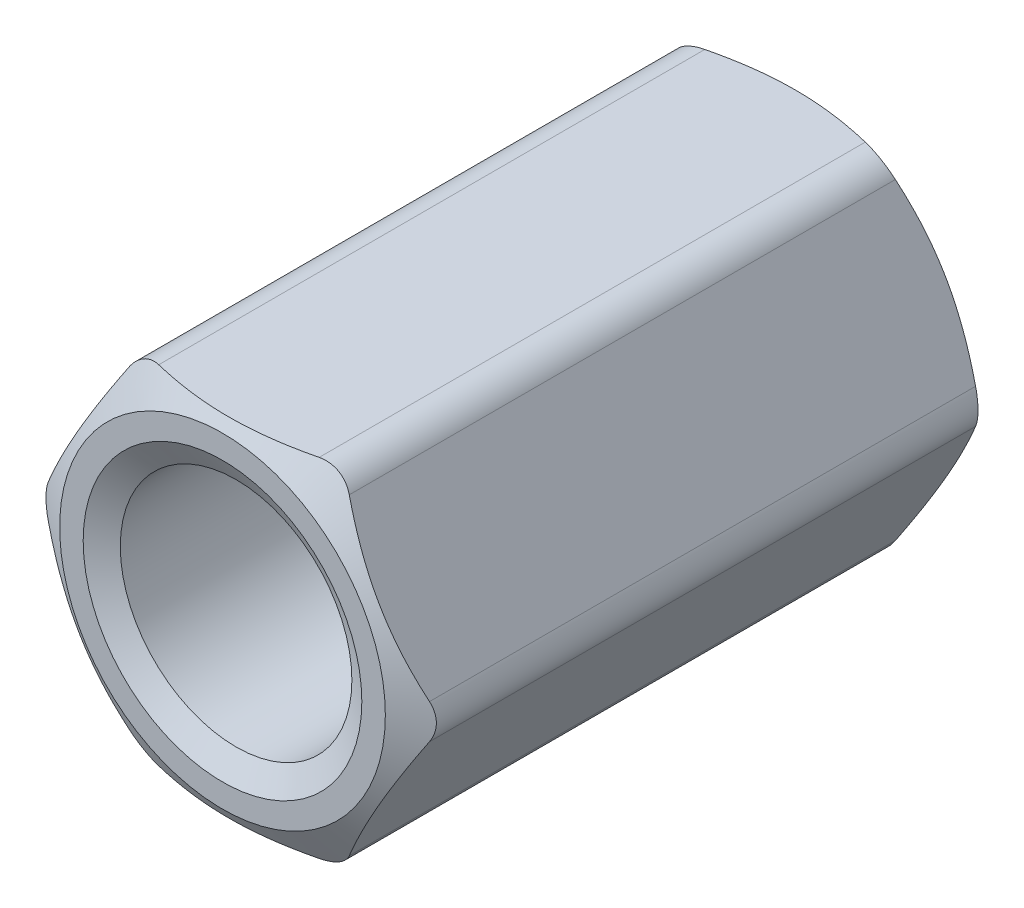
from build123d import *

# Parameters (mm, degrees)
SKETCH4_R           = 2.5
BOSS_EXTRUDE1_DEPTH = 5
SKETCH5_OUTSIDE_W   = 53.21
SKETCH5_OUTSIDE_H   = 52.282
SKETCH5_OUTSIDE_R   = 2.8125
CUT_EXTRUDE1_DEPTH  = 12
CUT_EXTRUDE1_DRAFT  = -60
SKETCH6_OUTSIDE_W   = 53.21
SKETCH6_OUTSIDE_H   = 52.282
SKETCH6_OUTSIDE_R   = 2.8125
CUT_EXTRUDE2_DEPTH  = 12
CUT_EXTRUDE2_DRAFT  = -60
FILLET1_R           = 0.6


with BuildPart() as part:
    # Sketch3 → Revolve1 (revolve)
    with BuildSketch(Plane(origin=(0, 0, 0), x_dir=(0, 0, -1), z_dir=(1, 0, 0)), mode=Mode.PRIVATE) as revolve1_sk:
        Polygon((5, 2.40625), (5, 3), (0, 3), (-5, 3), (-5, 2.40625), (-4.765451453, 2), (4.765451453, 2), align=None)
        Polygon((5, 2.40625), (5, 3), (0, 3), (-5, 3), (-5, 2.40625), (-4.765451453, 2), (4.765451453, 2), align=None)
    revolve(revolve1_sk.sketch.rotate(Axis((0, 0, -5), (0, 0, 1)), 90), axis=Axis((0, 0, -5), (0, 0, 1)))

    # Sketch4 → Boss-Extrude1 (add, symmetric)
    with BuildSketch(Plane.XY):
        Polygon((-1.732050808, 3), (-3.464101615, 0), (-1.732050808, -3), (1.732050808, -3), (3.464101615, 0), (1.732050808, 3), align=None)
        Circle(SKETCH4_R, mode=Mode.SUBTRACT)
    extrude(amount=BOSS_EXTRUDE1_DEPTH, both=True)


with BuildPart() as cut_extrude1_tool:
    # Sketch5 outside → Cut-Extrude1 (with draft: the straight prism first)
    with BuildSketch(Plane.XY.offset(5)):
        Rectangle(SKETCH5_OUTSIDE_W, SKETCH5_OUTSIDE_H)
        Circle(SKETCH5_OUTSIDE_R, mode=Mode.SUBTRACT)
    extrude(amount=-CUT_EXTRUDE1_DEPTH)
    # Cut-Extrude1: the draft: its side faces are tilted about the plane it starts from
    cut_extrude1_sides = [cut_extrude1_tool.faces().sort_by_distance(p)[0] for p in [
        (0, -26.141, -1),
        (26.605, 0, -1),
        (0, 26.141, -1),
        (-26.605, 0, -1),
        (-2.8125, 0, -1),
    ]]
    draft(cut_extrude1_sides, Plane.XY.offset(5), CUT_EXTRUDE1_DRAFT)


with BuildPart() as part_1:
    add(part.part)

    # Cut-Extrude1: cut by cut_extrude1_tool
    add(cut_extrude1_tool.part, mode=Mode.SUBTRACT)


with BuildPart() as cut_extrude2_tool:
    # Sketch6 outside → Cut-Extrude2 (with draft: the straight prism first)
    with BuildSketch(Plane(origin=(0, 0, -5), x_dir=(-1, 0, 0), z_dir=(0, 0, -1))):
        Rectangle(SKETCH6_OUTSIDE_W, SKETCH6_OUTSIDE_H)
        Circle(SKETCH6_OUTSIDE_R, mode=Mode.SUBTRACT)
    extrude(amount=-CUT_EXTRUDE2_DEPTH)
    # Cut-Extrude2: the draft: its side faces are tilted about the plane it starts from
    cut_extrude2_sides = [cut_extrude2_tool.faces().sort_by_distance(p)[0] for p in [
        (0, -26.141, 1),
        (-26.605, 0, 1),
        (0, 26.141, 1),
        (26.605, 0, 1),
        (2.8125, 0, 1),
    ]]
    draft(cut_extrude2_sides, Plane(origin=(0, 0, -5), x_dir=(-1, 0, 0), z_dir=(0, 0, -1)), CUT_EXTRUDE2_DRAFT)


with BuildPart() as part_2:
    add(part_1.part)

    # Cut-Extrude2: cut by cut_extrude2_tool
    add(cut_extrude2_tool.part, mode=Mode.SUBTRACT)

    # Fillet1
    # the kernel refuses this fillet: 0.6 mm, written as the material it takes off along each edge
    with BuildSketch(Plane(origin=(1.732050808, 3, 5.489823036), x_dir=(0.4999999999999995, -0.866025403784439, 0), z_dir=(0, 0, -1)), Plane(origin=(-3.464101615, 0, -5.489823036), x_dir=(0.5000000000000011, -0.8660254037844379, 0), z_dir=(0, 0, 1)), Plane(origin=(3.464101615, 0, 5.489823036), x_dir=(-0.4999999999999996, -0.8660254037844388, 0), z_dir=(0, 0, -1)), Plane(origin=(-1.732050808, 3, 5.489823036), x_dir=(1, 0, 0), z_dir=(0, 0, -1))) as fillet1_piece_1:
        with BuildLine():
            CenterArc((FILLET1_R * 0.57735026919, FILLET1_R), FILLET1_R, 210, 60)
            Line((-FILLET1_R * 0.288675134595, FILLET1_R * 0.5), (0, 0))
            Line((0, 0), (FILLET1_R * 0.57735026919, 0))
        make_face()
    extrude(amount=10.979646072, mode=Mode.SUBTRACT)
    with BuildSketch(Plane(origin=(-1.732050808, -3, -5.489823036), x_dir=(-0.5000000000000002, 0.8660254037844385, 0), z_dir=(0, 0, 1)), Plane(origin=(1.732050808, -3, -5.489823036), x_dir=(-1, 0, 0), z_dir=(0, 0, 1))) as fillet1_piece_2:
        with BuildLine():
            CenterArc((FILLET1_R * 0.57735026919, -FILLET1_R), FILLET1_R, 90, 60)
            Line((-FILLET1_R * 0.288675134595, -FILLET1_R * 0.5), (0, 0))
            Line((0, 0), (FILLET1_R * 0.57735026919, 0))
        make_face()
    extrude(amount=10.979646072, mode=Mode.SUBTRACT)


solid = part_2.part
